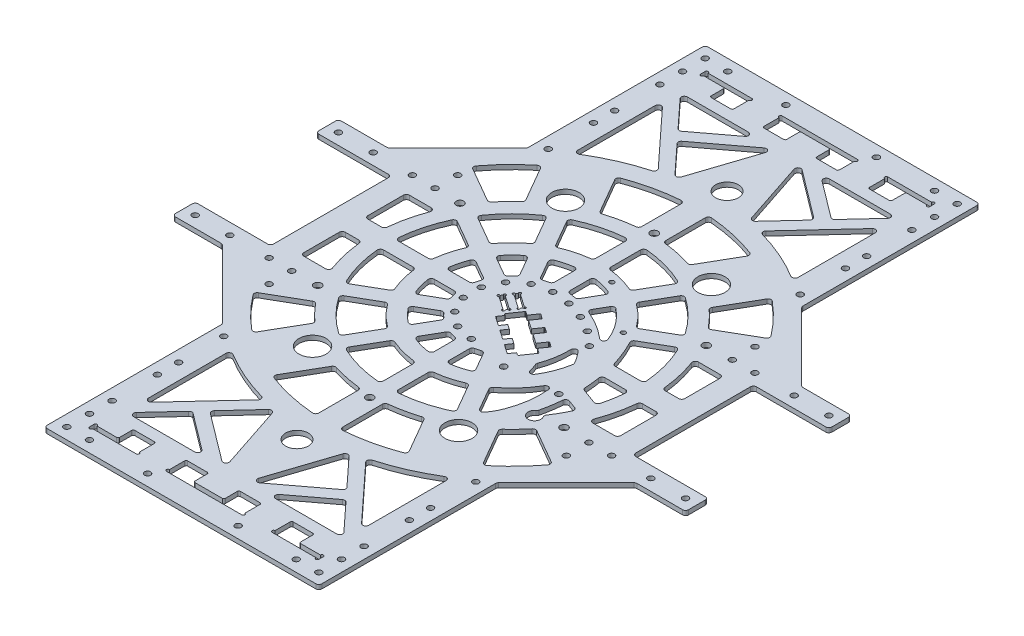
from build123d import *

# Parameters (mm, degrees)
EXTRUDE_2_OUTLINE_R   = 135
EXTRUDE_2_OUTLINE_R_2 = 2
EXTRUDE_2_DEPTH       = 3
SKETCH_7_R            = 2.5
SKETCH_7_R_2          = 1.5
CUT_EXTRUDE_3_DEPTH   = 191.942399692
EXTRUDE_START         = -3
SKETCH_8_R            = 135
EXTRUDE_3_DEPTH       = 3
SKETCH_9_R            = 0.75
SKETCH_9_R_2          = 2
SKETCH_9_W            = 31
SKETCH_9_H            = 3
SKETCH_9_W_2          = 50
SKETCH_9_H_2          = 80
CUT_EXTRUDE_4_DEPTH   = 278.254395817
FILLET_1_R            = 0.5
SKETCH_10_R           = 9
CUT_EXTRUDE_5_DEPTH   = 278.254395817
SKETCH_12_W           = 10
SKETCH_12_H           = 55
SKETCH_12_W_2         = 30
SKETCH_12_H_2         = 10
SKETCH_12_W_3         = 55
EXTRUDE_2_2_DEPTH     = 3
SKETCH_22_R           = 7.5
SKETCH_22_R_2         = 4.25
SKETCH_22_W           = 15
SKETCH_22_H           = 10
CUT_EXTRUDE_10_DEPTH  = 278.254395817
SKETCH_23_R           = 1
CUT_EXTRUDE_11_DEPTH  = 278.254395817
FILLET_2_R            = 2
FILLET_3_R            = 1
FILLET_5_R            = 2


with BuildPart() as part:
    # Extrude 2: read off the stored shape, not the designer's step
    # Extrude 2 outline → Extrude 2 (new body)
    with BuildSketch(Plane(origin=(0, 0, 0), x_dir=(1, 0, 0), z_dir=(0, 1, 0))):
        Circle(EXTRUDE_2_OUTLINE_R)
        with Locations((-11.714860956, -24.326159433)):
            Circle(EXTRUDE_2_OUTLINE_R_2, mode=Mode.SUBTRACT)
        with Locations((-21.109450027, -16.83422465)):
            Circle(EXTRUDE_2_OUTLINE_R_2, mode=Mode.SUBTRACT)
        with Locations((-26.323053629, -6.008065217)):
            Circle(EXTRUDE_2_OUTLINE_R_2, mode=Mode.SUBTRACT)
        with Locations((0, -27)):
            Circle(EXTRUDE_2_OUTLINE_R_2, mode=Mode.SUBTRACT)
        with Locations((60.645656918, -29.637042648)):
            Circle(EXTRUDE_2_OUTLINE_R_2, mode=Mode.SUBTRACT)
        with Locations((-26.323053629, 6.008065217)):
            Circle(EXTRUDE_2_OUTLINE_R_2, mode=Mode.SUBTRACT)
        with Locations((-21.109450027, 16.83422465)):
            Circle(EXTRUDE_2_OUTLINE_R_2, mode=Mode.SUBTRACT)
        with Locations((-11.714860956, 24.326159433)):
            Circle(EXTRUDE_2_OUTLINE_R_2, mode=Mode.SUBTRACT)
        with Locations((0, 27)):
            Circle(EXTRUDE_2_OUTLINE_R_2, mode=Mode.SUBTRACT)
        with Locations((12.026602226, 25.643716044)):
            Circle(EXTRUDE_2_OUTLINE_R_2, mode=Mode.SUBTRACT)
        with Locations((23.511562116, 21.826077559)):
            Circle(EXTRUDE_2_OUTLINE_R_2, mode=Mode.SUBTRACT)
        with Locations((43.261705064, 8.026510757)):
            Circle(EXTRUDE_2_OUTLINE_R_2, mode=Mode.SUBTRACT)
        with Locations((34.053247629, 15.880361974)):
            Circle(EXTRUDE_2_OUTLINE_R_2, mode=Mode.SUBTRACT)
    extrude(amount=EXTRUDE_2_DEPTH)

    # 草图7 → 切除-拉伸3 (cut, through all)
    with BuildSketch(Plane(origin=(0, 3, 0), x_dir=(1, 0, 0), z_dir=(0, 1, 0))):
        with Locations(Location((81.622894307, 47.125, 0), (0, 0, 270))):
            Circle(SKETCH_7_R)
        with Locations(Location((81.622894307, -47.125, 0), (0, 0, 270))):
            Circle(SKETCH_7_R)
        with Locations(Location((0, -94.25, 0), (0, 0, 270))):
            Circle(SKETCH_7_R)
        with Locations(Location((-81.622894307, -47.125, 0), (0, 0, 270))):
            Circle(SKETCH_7_R)
        with Locations(Location((-81.622894307, 47.125, 0), (0, 0, 270))):
            Circle(SKETCH_7_R)
        with Locations(Location((0, 94.25, 0), (0, 0, 270))):
            Circle(SKETCH_7_R)
        with Locations(Location((13.976228436, 52.15999462, 0), (0, 0, 270))):
            Circle(SKETCH_7_R_2)
        with Locations(Location((46.765371804, 27, 0), (0, 0, 270))):
            Circle(SKETCH_7_R_2)
        Polygon((2.302441407, 6.84642908), (-3.498658194, -1.543281489), (24.878304022, -21.164647786), (30.679403623, -12.774937218), align=None)
        Polygon((-10.035368253, 15.377457905), (-11.741574018, 12.909895973), (-1.87132629, 6.085072913), (-0.165120525, 8.552634845), align=None)
        Polygon((-5.966220126, 0.162924276), (-4.260014361, 2.630486208), (-14.130262089, 9.455309268), (-15.836467854, 6.987747336), align=None)
    extrude(amount=-CUT_EXTRUDE_3_DEPTH, mode=Mode.SUBTRACT)

    # 草图8 → 凸台-拉伸3 (add)
    with BuildSketch(Plane(origin=(0, 3, 0), x_dir=(1, 0, 0), z_dir=(0, 1, 0)).offset(EXTRUDE_START)):
        Polygon((170, 55), (170, -55), (137, -55), (91, -101), (91, -219), (-91, -219), (-91, -101), (-137, -55), (-170, -55), (-170, 55), (-137, 55), (-91, 101), (-91, 219), (91, 219), (91, 101), (137, 55), align=None)
        Circle(SKETCH_8_R, mode=Mode.SUBTRACT)
    extrude(amount=EXTRUDE_3_DEPTH)

    # 草图9 → 切除-拉伸4 (cut, through all)
    with BuildSketch(Plane(origin=(0, 3, 0), x_dir=(1, 0, 0), z_dir=(0, 1, 0))):
        with Locations((-1.87132629, 6.085072913)):
            Circle(SKETCH_9_R)
        with Locations((-0.165120525, 8.552634845)):
            Circle(SKETCH_9_R)
        with Locations((-10.035368253, 15.377457905)):
            Circle(SKETCH_9_R)
        with Locations((-11.741574018, 12.909895973)):
            Circle(SKETCH_9_R)
        with Locations((-14.130262089, 9.455309268)):
            Circle(SKETCH_9_R)
        with Locations((-15.836467854, 6.987747336)):
            Circle(SKETCH_9_R)
        with Locations((-4.260014361, 2.630486208)):
            Circle(SKETCH_9_R)
        with Locations((-5.966220126, 0.162924276)):
            Circle(SKETCH_9_R)
        with Locations(Location((162.5, 47.5, 0), (0, 0, 270))):
            Circle(SKETCH_9_R_2)
        with Locations(Location((139.5, 47.5, 0), (0, 0, 270))):
            Circle(SKETCH_9_R_2)
        with Locations(Location((98.5, 62.5, 0), (0, 0, 270))):
            Circle(SKETCH_9_R_2)
        with Locations(Location((98.5, 47.5, 0), (0, 0, 270))):
            Circle(SKETCH_9_R_2)
        with Locations(Location((113.5, 47.5, 0), (0, 0, 270))):
            Circle(SKETCH_9_R_2)
        with Locations(Location((162.5, -47.5, 0), (0, 0, 90))):
            Circle(SKETCH_9_R_2)
        with Locations(Location((139.5, -47.5, 0), (0, 0, 90))):
            Circle(SKETCH_9_R_2)
        with Locations(Location((113.5, -47.5, 0), (0, 0, 90))):
            Circle(SKETCH_9_R_2)
        with Locations(Location((98.5, -47.5, 0), (0, 0, 90))):
            Circle(SKETCH_9_R_2)
        with Locations(Location((98.5, -62.5, 0), (0, 0, 90))):
            Circle(SKETCH_9_R_2)
        with Locations(Location((-98.5, -62.5, 0), (0, 0, 270))):
            Circle(SKETCH_9_R_2)
        with Locations(Location((-98.5, -47.5, 0), (0, 0, 270))):
            Circle(SKETCH_9_R_2)
        with Locations(Location((-113.5, -47.5, 0), (0, 0, 270))):
            Circle(SKETCH_9_R_2)
        with Locations(Location((-139.5, -47.5, 0), (0, 0, 270))):
            Circle(SKETCH_9_R_2)
        with Locations(Location((-162.5, -47.5, 0), (0, 0, 270))):
            Circle(SKETCH_9_R_2)
        with Locations(Location((-113.5, 47.5, 0), (0, 0, 90))):
            Circle(SKETCH_9_R_2)
        with Locations(Location((-98.5, 47.5, 0), (0, 0, 90))):
            Circle(SKETCH_9_R_2)
        with Locations(Location((-98.5, 62.5, 0), (0, 0, 90))):
            Circle(SKETCH_9_R_2)
        with Locations(Location((-139.5, 47.5, 0), (0, 0, 90))):
            Circle(SKETCH_9_R_2)
        with Locations(Location((-162.5, 47.5, 0), (0, 0, 90))):
            Circle(SKETCH_9_R_2)
        with Locations(Location((68.5, 211.5, 0), (0, 0, 270))):
            Circle(SKETCH_9_R_2)
        with Locations(Location((83.5, 211.5, 0), (0, 0, 270))):
            Circle(SKETCH_9_R_2)
        with Locations(Location((83.5, 196.5, 0), (0, 0, 270))):
            Circle(SKETCH_9_R_2)
        with Locations(Location((83.5, 181.5, 0), (0, 0, 270))):
            Circle(SKETCH_9_R_2)
        with Locations(Location((83.5, 151.5, 0), (0, 0, 270))):
            Circle(SKETCH_9_R_2)
        with Locations(Location((83.5, -181.5, 0), (0, 0, 90))):
            Circle(SKETCH_9_R_2)
        with Locations(Location((83.5, -196.5, 0), (0, 0, 90))):
            Circle(SKETCH_9_R_2)
        with Locations(Location((83.5, -211.5, 0), (0, 0, 90))):
            Circle(SKETCH_9_R_2)
        with Locations(Location((68.5, -211.5, 0), (0, 0, 90))):
            Circle(SKETCH_9_R_2)
        with Locations(Location((-83.5, 181.5, 0), (0, 0, 90))):
            Circle(SKETCH_9_R_2)
        with Locations(Location((-83.5, 196.5, 0), (0, 0, 90))):
            Circle(SKETCH_9_R_2)
        with Locations(Location((-83.5, 211.5, 0), (0, 0, 90))):
            Circle(SKETCH_9_R_2)
        with Locations(Location((-68.5, 211.5, 0), (0, 0, 90))):
            Circle(SKETCH_9_R_2)
        with Locations(Location((-68.5, -211.5, 0), (0, 0, 270))):
            Circle(SKETCH_9_R_2)
        with Locations(Location((-83.5, -211.5, 0), (0, 0, 270))):
            Circle(SKETCH_9_R_2)
        with Locations(Location((-83.5, -196.5, 0), (0, 0, 270))):
            Circle(SKETCH_9_R_2)
        with Locations(Location((-83.5, -181.5, 0), (0, 0, 270))):
            Circle(SKETCH_9_R_2)
        with Locations(Location((30, 211.5, 0), (0, 0, 270))):
            Circle(SKETCH_9_R_2)
        with Locations(Location((-30, 211.5, 0), (0, 0, 90))):
            Circle(SKETCH_9_R_2)
        with Locations(Location((-30, -211.5, 0), (0, 0, 270))):
            Circle(SKETCH_9_R_2)
        with Locations(Location((30, -211.5, 0), (0, 0, 90))):
            Circle(SKETCH_9_R_2)
        with Locations(Location((83.5, 137.5, 0), (0, 0, 270))):
            Circle(SKETCH_9_R_2)
        with Locations(Location((83.5, 107.5, 0), (0, 0, 270))):
            Circle(SKETCH_9_R_2)
        with Locations(Location((-83.5, 107.5, 0), (0, 0, 90))):
            Circle(SKETCH_9_R_2)
        with Locations(Location((-83.5, 137.5, 0), (0, 0, 90))):
            Circle(SKETCH_9_R_2)
        with Locations(Location((-83.5, 151.5, 0), (0, 0, 90))):
            Circle(SKETCH_9_R_2)
        with Locations(Location((83.5, -151.5, 0), (0, 0, 90))):
            Circle(SKETCH_9_R_2)
        with Locations(Location((-83.5, -151.5, 0), (0, 0, 270))):
            Circle(SKETCH_9_R_2)
        with Locations(Location((83.5, -107.5, 0), (0, 0, 90))):
            Circle(SKETCH_9_R_2)
        with Locations(Location((83.5, -137.5, 0), (0, 0, 90))):
            Circle(SKETCH_9_R_2)
        with Locations(Location((-83.5, -137.5, 0), (0, 0, 270))):
            Circle(SKETCH_9_R_2)
        with Locations(Location((-83.5, -107.5, 0), (0, 0, 270))):
            Circle(SKETCH_9_R_2)
        Polygon((17.843517837, 4.003025594), (8.345639079, -9.73306916), (6.988480016, -8.79465599), (4.429171369, -12.495998888), (10.598076198, -16.7615133), (13.157384846, -13.060170402), (11.800225783, -12.121757231), (21.298104542, 1.614337523), align=None)
        Polygon((-2.306003261, -2.367947608), (-4.865311908, -6.069290506), (1.303592922, -10.334804919), (3.862901569, -6.633462021), (2.505742507, -5.69504885), (12.003621265, 8.041045904), (8.54903456, 10.429733975), (-0.948844198, -3.306360779), align=None)
        Polygon((21.588221446, -18.889706766), (31.086100205, -5.153612012), (27.6315135, -2.764923941), (18.133634742, -16.501018695), (16.776475679, -15.562605524), (14.217167032, -19.263948422), (20.386071861, -23.529462834), (22.945380509, -19.828119937), align=None)
        with Locations((-60.5, 202.5)):
            Rectangle(SKETCH_9_W, SKETCH_9_H)
        with Locations((60.5, 202.5)):
            Rectangle(SKETCH_9_W, SKETCH_9_H)
        with Locations((-145, 0)):
            Rectangle(SKETCH_9_W_2, SKETCH_9_H_2)
        with Locations((145, 0)):
            Rectangle(SKETCH_9_W_2, SKETCH_9_H_2)
        with Locations((0, 202.5)):
            Rectangle(SKETCH_9_W_2, SKETCH_9_H)
        with Locations((-60.5, -202.5)):
            Rectangle(SKETCH_9_W, SKETCH_9_H)
        with Locations((0, -202.5)):
            Rectangle(SKETCH_9_W_2, SKETCH_9_H)
        with Locations((60.5, -202.5)):
            Rectangle(SKETCH_9_W, SKETCH_9_H)
    extrude(amount=-CUT_EXTRUDE_4_DEPTH, mode=Mode.SUBTRACT)

    # 圆角1
    fillet_1_edges = [part.edges().sort_by_distance(p)[0] for p in [
        (2.302441407, 1.5, -6.84642908),
        (30.679403623, 1.5, 12.774937218),
        (24.878304022, 1.5, 21.164647786),
        (-3.498658194, 1.5, 1.543281489),
        (21.298104542, 1.5, -1.614337523),
        (4.429171369, 1.5, 12.495998888),
        (17.843517837, 1.5, -4.003025594),
        (10.598076198, 1.5, 16.7615133),
        (31.086100205, 1.5, 5.153612012),
        (14.217167032, 1.5, 19.263948422),
        (27.6315135, 1.5, 2.764923941),
        (20.386071861, 1.5, 23.529462834),
        (12.003621265, 1.5, -8.041045904),
        (8.54903456, 1.5, -10.429733975),
        (1.303592922, 1.5, 10.334804919),
        (-4.865311908, 1.5, 6.069290506),
    ]]
    fillet(fillet_1_edges, radius=FILLET_1_R)

    # 草图10 → 切除-拉伸5 (cut, through all)
    with BuildSketch(Plane(origin=(0, 3, 0), x_dir=(1, 0, 0), z_dir=(0, 1, 0))):
        with Locations(Location((-48.375, 83.787957816, 0), (0, 0, 270))):
            Circle(SKETCH_10_R)
        with Locations(Location((48.375, 83.787957816, 0), (0, 0, 270))):
            Circle(SKETCH_10_R)
        with Locations(Location((48.375, -83.787957816, 0), (0, 0, 270))):
            Circle(SKETCH_10_R)
        with Locations(Location((-48.375, -83.787957816, 0), (0, 0, 270))):
            Circle(SKETCH_10_R)
        with BuildLine():
            ThreePointArc((49.077709935, 32.747189003), (-58.972573029, -1.798785793), (50.982330794, -29.695150225))
            ThreePointArc((50.982330794, -29.695150225), (53.143344948, -28.74915581), (54.702238888, -30.519674744))
            ThreePointArc((54.702238888, -30.519674744), (54.388557403, -43.597514939), (51.097814518, -56.258451378))
            ThreePointArc((51.097814518, -56.258451378), (43.410017969, -68.216294527), (31.641546407, -76.190961019))
            ThreePointArc((31.641546407, -76.190961019), (-50.864784063, 64.954012518), (66.382772067, -48.985483285))
            ThreePointArc((66.382772067, -48.985483285), (63.918206381, -49.605851668), (62.834701724, -47.306947883))
            ThreePointArc((62.834701724, -47.306947883), (64.450515138, -5.820165452), (49.077709935, 32.747189003))
        make_face()
        with BuildLine():
            ThreePointArc((47.879261128, 10.419997784), (-45.759993791, 17.522070889), (28.674854812, -39.733521132))
            ThreePointArc((28.674854812, -39.733521132), (28.938606013, -35.765708372), (28.691050958, -31.796852203))
            ThreePointArc((28.691050958, -31.796852203), (28.264061739, -30.794139817), (27.37474082, -30.164171385))
            ThreePointArc((27.37474082, -30.164171385), (19.028783253, -28.72993028), (10.682825686, -30.164171385))
            ThreePointArc((10.682825686, -30.164171385), (-31.537703505, -5.419710104), (4.1e-08, 32))
            ThreePointArc((4.1e-08, 32), (6.611735111, 31.628363067), (13.140176467, 30.518134205))
            ThreePointArc((13.140176467, 30.518134205), (32.027953382, 23.09329337), (47.879261128, 10.419997784))
        make_face()
        with BuildLine():
            ThreePointArc((38.570016524, -30.221744247), (37.469285963, -24.834509029), (35.65634663, -19.643443431))
            ThreePointArc((35.65634663, -19.643443431), (38.766523838, -7.204776194), (38.611094695, 5.615890195))
            ThreePointArc((38.611094695, 5.615890195), (43.988206529, -0.464963146), (48.462510212, -7.23775545))
            ThreePointArc((48.462510212, -7.23775545), (45.008122742, -19.371858125), (38.570016524, -30.221744247))
        make_face()
    extrude(amount=-CUT_EXTRUDE_5_DEPTH, mode=Mode.SUBTRACT)

    # 草图12 → Extrude 2 2 (add)
    with BuildSketch(Plane(origin=(0, 3, 0), x_dir=(1, 0, 0), z_dir=(0, 1, 0))):
        with Locations((0, 56.5)):
            Rectangle(SKETCH_12_W, SKETCH_12_H)
        Polygon((19.70900895, 24.137004868), (46.330127019, 70.246133918), (37.669872981, 75.246133918), (11.048754912, 29.137004868), align=None)
        Polygon((50.997422612, 23.669872981), (75.246133918, 37.669872981), (70.246133918, 46.330127019), (45.997422612, 32.330127019), align=None)
        with Locations((69, 0)):
            Rectangle(SKETCH_12_W_2, SKETCH_12_H_2)
        Polygon((10.798129487, -28.702908898), (37.669872981, -75.246133918), (46.330127019, -70.246133918), (19.458383525, -23.702908898), align=None)
        with Locations((0, -56.5)):
            Rectangle(SKETCH_12_W, SKETCH_12_H)
        Polygon((-18.792378281, -22.549353978), (-46.330127019, -70.246133918), (-37.669872981, -75.246133918), (-10.132124243, -27.549353978), align=None)
        Polygon((-27.61473671, -10.169872981), (-75.246133918, -37.669872981), (-70.246133918, -46.330127019), (-22.61473671, -18.830127019), align=None)
        with Locations((-56.5, 0)):
            Rectangle(SKETCH_12_W_3, SKETCH_12_H_2)
        Polygon((-22.61473671, 18.830127019), (-70.246133918, 46.330127019), (-75.246133918, 37.669872981), (-27.61473671, 10.169872981), align=None)
        Polygon((-10.169872981, 27.61473671), (-37.669872981, 75.246133918), (-46.330127019, 70.246133918), (-18.830127019, 22.61473671), align=None)
        Polygon((49.033300806, -23.167550844), (77.224079429, -33.428155143), (80.644280863, -24.031228935), (52.453502239, -13.770624636), align=None)
    extrude(amount=-EXTRUDE_2_2_DEPTH)

    # 草图22 → 切除-拉伸10 (cut, through all)
    with BuildSketch(Plane(origin=(0, 3, 0), x_dir=(1, 0, 0), z_dir=(0, 1, 0))):
        with Locations(Location((0, 142.5, 0), (0, 0, 270))):
            Circle(SKETCH_22_R)
        with Locations((64.961443453, -50.040092571)):
            Circle(SKETCH_22_R_2)
        with Locations(Location((0, -142.5, 0), (0, 0, 90))):
            Circle(SKETCH_22_R)
        with BuildLine():
            Line((-105, 7.5), (-105, 35))
            Line((-105, 35), (-85.622718948, 35))
            ThreePointArc((-85.622718948, 35), (-89.966034254, 21.502620318), (-92.195444573, 7.5))
            Line((-92.195444573, 7.5), (-105, 7.5))
        make_face()
        with BuildLine():
            Line((29.77741647, 87.575998244), (44.996710059, 113.936587995))
            ThreePointArc((44.996710059, 113.936587995), (26.821507042, 119.527640151), (8, 122.238496391))
            Line((8, 122.238496391), (8, 92.153404712))
            ThreePointArc((8, 92.153404712), (19.026861572, 90.521978208), (29.77741647, 87.575998244))
        make_face()
        with BuildLine():
            Line((92.195444573, 7.5), (105, 7.5))
            Line((105, 7.5), (105, 35))
            Line((105, 35), (85.622718948, 35))
            ThreePointArc((85.622718948, 35), (89.966034254, 21.502620318), (92.195444573, 7.5))
        make_face()
        with BuildLine():
            Line((72.812278368, 57.049295515), (98.989039715, 72.162455725))
            ThreePointArc((98.989039715, 72.162455725), (88.384342976, 84.820150417), (76.173624595, 95.936587995))
            Line((76.173624595, 95.936587995), (60.954331006, 69.575998244))
            ThreePointArc((60.954331006, 69.575998244), (67.175933311, 63.589653119), (72.812278368, 57.049295515))
        make_face()
        with BuildLine():
            Line((105, -35), (85.622718948, -35))
            ThreePointArc((85.622718948, -35), (89.966034254, -21.502620318), (92.195444573, -7.5))
            Line((92.195444573, -7.5), (105, -7.5))
            Line((105, -7.5), (105, -35))
        make_face()
        with BuildLine():
            Line((33.504478555, 130.260124047), (73, 172.96570276))
            Line((73, 172.96570276), (73, 112.96570276))
            ThreePointArc((73, 112.96570276), (53.949747358, 123.205822752), (33.504478555, 130.260124047))
        make_face()
        with BuildLine():
            Line((-73, 172.96570276), (-73, 112.96570276))
            ThreePointArc((-73, 112.96570276), (-53.949747358, 123.205822752), (-33.504478555, 130.260124047))
            Line((-33.504478555, 130.260124047), (-73, 172.96570276))
        make_face()
        with BuildLine():
            Line((-60.954331006, 69.575998244), (-76.173624595, 95.936587995))
            ThreePointArc((-76.173624595, 95.936587995), (-88.384342976, 84.820150417), (-98.989039715, 72.162455725))
            Line((-98.989039715, 72.162455725), (-72.812278368, 57.049295515))
            ThreePointArc((-72.812278368, 57.049295515), (-67.175933311, 63.589653119), (-60.954331006, 69.575998244))
        make_face()
        with BuildLine():
            Line((-8, 92.153404712), (-8, 122.238496391))
            ThreePointArc((-8, 122.238496391), (-26.821507042, 119.527640151), (-44.996710059, 113.936587995))
            Line((-44.996710059, 113.936587995), (-29.77741647, 87.575998244))
            ThreePointArc((-29.77741647, 87.575998244), (-19.026861572, 90.521978208), (-8, 92.153404712))
        make_face()
        with BuildLine():
            Line((72.812278368, -57.049295515), (98.989039715, -72.162455725))
            ThreePointArc((98.989039715, -72.162455725), (88.384342976, -84.820150417), (76.173624595, -95.936587995))
            Line((76.173624595, -95.936587995), (60.954331006, -69.575998244))
            ThreePointArc((60.954331006, -69.575998244), (67.175933311, -63.589653119), (72.812278368, -57.049295515))
        make_face()
        with BuildLine():
            Line((-29.77741647, -87.575998244), (-44.996710059, -113.936587995))
            ThreePointArc((-44.996710059, -113.936587995), (-26.821507042, -119.527640151), (-8, -122.238496391))
            Line((-8, -122.238496391), (-8, -92.153404712))
            ThreePointArc((-8, -92.153404712), (-19.026861572, -90.521978208), (-29.77741647, -87.575998244))
        make_face()
        with BuildLine():
            Line((-72.812278368, -57.049295515), (-98.989039715, -72.162455725))
            ThreePointArc((-98.989039715, -72.162455725), (-88.384342976, -84.820150417), (-76.173624595, -95.936587995))
            Line((-76.173624595, -95.936587995), (-60.954331006, -69.575998244))
            ThreePointArc((-60.954331006, -69.575998244), (-67.175933311, -63.589653119), (-72.812278368, -57.049295515))
        make_face()
        with BuildLine():
            Line((8, -92.153404712), (8, -122.238496391))
            ThreePointArc((8, -122.238496391), (26.821507042, -119.527640151), (44.996710059, -113.936587995))
            Line((44.996710059, -113.936587995), (29.77741647, -87.575998244))
            ThreePointArc((29.77741647, -87.575998244), (19.026861572, -90.521978208), (8, -92.153404712))
        make_face()
        with BuildLine():
            Line((-92.195444573, -7.5), (-105, -7.5))
            Line((-105, -7.5), (-105, -35))
            Line((-105, -35), (-85.622718948, -35))
            ThreePointArc((-85.622718948, -35), (-89.966034254, -21.502620318), (-92.195444573, -7.5))
        make_face()
        with Locations((-52.5, 196)):
            Rectangle(SKETCH_22_W, SKETCH_22_H)
        with Locations((-17.5, 196)):
            Rectangle(SKETCH_22_W, SKETCH_22_H)
        with Locations((17.5, 196)):
            Rectangle(SKETCH_22_W, SKETCH_22_H)
        with Locations((52.5, 196)):
            Rectangle(SKETCH_22_W, SKETCH_22_H)
        with Locations((52.5, -196)):
            Rectangle(SKETCH_22_W, SKETCH_22_H)
        with Locations((17.5, -196)):
            Rectangle(SKETCH_22_W, SKETCH_22_H)
        with Locations((-17.5, -196)):
            Rectangle(SKETCH_22_W, SKETCH_22_H)
        with Locations((-52.5, -196)):
            Rectangle(SKETCH_22_W, SKETCH_22_H)
        Polygon((20.793956755, 183.5), (71.845665855, 183.5), (50.880248519, 160.830587178), align=None)
        Polygon((7.5, 183.5), (45.420816185, 154.927431358), (24.455398849, 132.258018536), align=None)
        Polygon((-20.793956755, 183.5), (-71.845665855, 183.5), (-50.880248519, 160.830587178), align=None)
        Polygon((-24.455398849, 132.258018536), (-7.5, 183.5), (-45.420816185, 154.927431358), align=None)
        with BuildLine():
            Line((-73, -172.96570276), (-73, -112.96570276))
            ThreePointArc((-73, -112.96570276), (-53.949747358, -123.205822752), (-33.504478555, -130.260124047))
            Line((-33.504478555, -130.260124047), (-73, -172.96570276))
        make_face()
        Polygon((-20.793956755, -183.5), (-71.845665855, -183.5), (-50.880248519, -160.830587178), align=None)
        Polygon((-7.5, -183.5), (-45.420816185, -154.927431358), (-24.455398849, -132.258018536), align=None)
        Polygon((24.455398849, -132.258018536), (7.5, -183.5), (45.420816185, -154.927431358), align=None)
        Polygon((50.880248519, -160.830587178), (20.793956755, -183.5), (71.845665855, -183.5), align=None)
        with BuildLine():
            Line((73, -172.96570276), (73, -112.96570276))
            ThreePointArc((73, -112.96570276), (53.949747358, -123.205822752), (33.504478555, -130.260124047))
            Line((33.504478555, -130.260124047), (73, -172.96570276))
        make_face()
    extrude(amount=-CUT_EXTRUDE_10_DEPTH, mode=Mode.SUBTRACT)

    # 草图23 → 切除-拉伸11 (cut, through all)
    with BuildSketch(Plane(origin=(0, 3, 0), x_dir=(1, 0, 0), z_dir=(0, 1, 0))):
        with Locations((75, 204)):
            Circle(SKETCH_23_R)
        with Locations((75, 201)):
            Circle(SKETCH_23_R)
        with Locations((45, 203)):
            Circle(SKETCH_23_R)
        with Locations((25, 203)):
            Circle(SKETCH_23_R)
        with Locations((-25, 203)):
            Circle(SKETCH_23_R)
        with Locations((-45, 203)):
            Circle(SKETCH_23_R)
        with Locations((-75, 201)):
            Circle(SKETCH_23_R)
        with Locations((-75, 204)):
            Circle(SKETCH_23_R)
        with Locations((-75, -204)):
            Circle(SKETCH_23_R)
        with Locations((-75, -201)):
            Circle(SKETCH_23_R)
        with Locations((-45, -203)):
            Circle(SKETCH_23_R)
        with Locations((-25, -203)):
            Circle(SKETCH_23_R)
        with Locations((25, -203)):
            Circle(SKETCH_23_R)
        with Locations((45, -203)):
            Circle(SKETCH_23_R)
        with Locations((75, -201)):
            Circle(SKETCH_23_R)
        with Locations((75, -204)):
            Circle(SKETCH_23_R)
    extrude(amount=-CUT_EXTRUDE_11_DEPTH, mode=Mode.SUBTRACT)

    # 圆角2
    fillet_2_edges = [part.edges().sort_by_distance(p)[0] for p in [
        (91, 1.5, -101),
        (91, 1.5, -219),
        (-91, 1.5, -219),
        (-91, 1.5, -101),
        (-137, 1.5, -55),
        (-170, 1.5, -55),
        (-170, 1.5, 55),
        (-137, 1.5, 55),
        (-91, 1.5, 101),
        (-91, 1.5, 219),
        (91, 1.5, 219),
        (91, 1.5, 101),
        (137, 1.5, 55),
        (170, 1.5, 55),
        (170, 1.5, -55),
        (137, 1.5, -55),
        (63.104135532, 1.5, 46.217409313),
        (67.85402572, 1.5, 46.926337952),
        (-170, 1.5, 40),
        (-170, 1.5, -40),
        (170, 1.5, -40),
        (170, 1.5, 40),
    ]]
    fillet(fillet_2_edges, radius=FILLET_2_R)

    # 圆角3
    fillet_3_edges = [part.edges().sort_by_distance(p)[0] for p in [
        (45, 1.5, 191),
        (60, 1.5, 191),
        (60, 1.5, 201),
        (60, 1.5, -201),
        (60, 1.5, -191),
        (45, 1.5, -191),
        (25, 1.5, 191),
        (10, 1.5, 201),
        (10, 1.5, 191),
        (-10, 1.5, 201),
        (-25, 1.5, 191),
        (-10, 1.5, 191),
        (-60, 1.5, 201),
        (-60, 1.5, 191),
        (-45, 1.5, 191),
        (-45, 1.5, -191),
        (-60, 1.5, -191),
        (-60, 1.5, -201),
        (-25, 1.5, -191),
        (-10, 1.5, -201),
        (-10, 1.5, -191),
        (10, 1.5, -201),
        (25, 1.5, -191),
        (10, 1.5, -191),
    ]]
    fillet(fillet_3_edges, radius=FILLET_3_R)

    # 圆角5
    fillet_5_edges = [part.edges().sort_by_distance(p)[0] for p in [
        (73.815759128, 1.5, -36.844045711),
        (68.815759128, 1.5, -45.504299749),
        (28.702242233, 1.5, -39.713741838),
        (20.041988195, 1.5, -44.713741838),
        (36.844045711, 1.5, -73.815759128),
        (25.063749894, 1.5, -53.411688245),
        (11.990804121, 1.5, -30.768681962),
        (33.724003932, 1.5, -48.411688245),
        (21.877835654, 1.5, -27.893522913),
        (45.504299749, 1.5, -68.815759128),
        (36.712855229, 1.5, 73.588530547),
        (44.490119117, 1.5, 67.059146746),
        (33.724003932, 1.5, 48.411688245),
        (22.500594818, 1.5, 28.972173426),
        (28.682011536, 1.5, 39.678701244),
        (11.486298547, 1.5, 29.894852675),
        (20.041988195, 1.5, 44.713741838),
        (25.063749894, 1.5, 53.411688245),
        (64.306054367, 1.5, 5),
        (61.965830603, 1.5, -5),
        (82.34834546, 1.5, -5),
        (82.34834546, 1.5, 5),
        (5, 1.5, 31.606961259),
        (5, 1.5, 48.744230428),
        (5, 1.5, 82.34834546),
        (5, 1.5, 58.787753827),
        (-5, 1.5, 31.606961259),
        (-5, 1.5, 58.787753827),
        (-5, 1.5, 48.744230428),
        (-5, 1.5, 82.34834546),
        (-11.47335361, 1.5, 29.872431386),
        (-20.041988195, 1.5, 44.713741838),
        (-36.844045711, 1.5, 73.815759128),
        (-25.063749894, 1.5, 53.411688245),
        (-20.133607648, 1.5, 24.872431386),
        (-33.724003932, 1.5, 48.411688245),
        (-28.702242233, 1.5, 39.713741838),
        (-45.504299749, 1.5, 68.815759128),
        (-24.872431386, 1.5, 20.133607648),
        (-39.713741838, 1.5, 28.702242233),
        (-68.815759128, 1.5, 45.504299749),
        (-48.411688245, 1.5, 33.724003932),
        (-29.872431386, 1.5, 11.47335361),
        (-53.411688245, 1.5, 25.063749894),
        (-44.713741838, 1.5, 20.041988195),
        (-73.815759128, 1.5, 36.844045711),
        (-31.606961259, 1.5, 5),
        (-48.744230428, 1.5, 5),
        (-82.34834546, 1.5, 5),
        (-58.787753827, 1.5, 5),
        (-31.606961259, 1.5, -5),
        (-58.787753827, 1.5, -5),
        (-48.744230428, 1.5, -5),
        (-82.34834546, 1.5, -5),
        (-29.872431386, 1.5, -11.47335361),
        (-44.713741838, 1.5, -20.041988195),
        (-73.815759128, 1.5, -36.844045711),
        (-53.411688245, 1.5, -25.063749894),
        (-24.872431386, 1.5, -20.133607648),
        (-48.411688245, 1.5, -33.724003932),
        (-39.713741838, 1.5, -28.702242233),
        (-68.815759128, 1.5, -45.504299749),
        (-20.133607648, 1.5, -24.872431386),
        (-28.702242233, 1.5, -39.713741838),
        (-45.504299749, 1.5, -68.815759128),
        (-33.724003932, 1.5, -48.411688245),
        (-11.47335361, 1.5, -29.872431386),
        (-25.063749894, 1.5, -53.411688245),
        (-20.041988195, 1.5, -44.713741838),
        (-36.844045711, 1.5, -73.815759128),
        (65.685501248, 1.5, 29.228456139),
        (65.810056675, 1.5, 18.632012883),
        (79.092233279, 1.5, 23.466329813),
        (75.672031846, 1.5, 32.863256021),
        (8, 1.5, 92.153404712),
        (29.77741647, 1.5, 87.575998244),
        (44.996710059, 1.5, 113.936587995),
        (8, 1.5, 122.238496391),
        (33.504478555, 1.5, 130.260124047),
        (73, 1.5, 112.96570276),
        (73, 1.5, 172.96570276),
        (-105, 1.5, 35),
        (-105, 1.5, 7.5),
        (-92.195444573, 1.5, 7.5),
        (-85.622718948, 1.5, 35),
        (-8, 1.5, 122.238496391),
        (-44.996710059, 1.5, 113.936587995),
        (-29.77741647, 1.5, 87.575998244),
        (-8, 1.5, 92.153404712),
        (-72.812278368, 1.5, 57.049295515),
        (-60.954331006, 1.5, 69.575998244),
        (-76.173624595, 1.5, 95.936587995),
        (-98.989039715, 1.5, 72.162455725),
        (-73, 1.5, 112.96570276),
        (-33.504478555, 1.5, 130.260124047),
        (-73, 1.5, 172.96570276),
        (-50.880248519, 1.5, 160.830587178),
        (-20.793956755, 1.5, 183.5),
        (-71.845665855, 1.5, 183.5),
        (-24.455398849, 1.5, 132.258018536),
        (-7.5, 1.5, 183.5),
        (-45.420816185, 1.5, 154.927431358),
        (-20.793956755, 1.5, -183.5),
        (-50.880248519, 1.5, -160.830587178),
        (-71.845665855, 1.5, -183.5),
        (-24.455398849, 1.5, -132.258018536),
        (-45.420816185, 1.5, -154.927431358),
        (-7.5, 1.5, -183.5),
        (-85.622718948, 1.5, -35),
        (-92.195444573, 1.5, -7.5),
        (-105, 1.5, -7.5),
        (-105, 1.5, -35),
        (73, 1.5, -112.96570276),
        (33.504478555, 1.5, -130.260124047),
        (73, 1.5, -172.96570276),
        (105, 1.5, -35),
        (105, 1.5, -7.5),
        (92.195444573, 1.5, -7.5),
        (85.622718948, 1.5, -35),
        (50.880248519, 1.5, -160.830587178),
        (20.793956755, 1.5, -183.5),
        (71.845665855, 1.5, -183.5),
        (105, 1.5, 7.5),
        (105, 1.5, 35),
        (85.622718948, 1.5, 35),
        (92.195444573, 1.5, 7.5),
        (76.173624595, 1.5, -95.936587995),
        (98.989039715, 1.5, -72.162455725),
        (72.812278368, 1.5, -57.049295515),
        (60.954331006, 1.5, -69.575998244),
        (60.954331006, 1.5, 69.575998244),
        (72.812278368, 1.5, 57.049295515),
        (98.989039715, 1.5, 72.162455725),
        (76.173624595, 1.5, 95.936587995),
        (24.455398849, 1.5, -132.258018536),
        (7.5, 1.5, -183.5),
        (45.420816185, 1.5, -154.927431358),
        (-33.504478555, 1.5, -130.260124047),
        (-73, 1.5, -112.96570276),
        (-73, 1.5, -172.96570276),
        (-98.989039715, 1.5, -72.162455725),
        (-76.173624595, 1.5, -95.936587995),
        (-60.954331006, 1.5, -69.575998244),
        (-72.812278368, 1.5, -57.049295515),
        (-8, 1.5, -92.153404712),
        (-29.77741647, 1.5, -87.575998244),
        (-44.996710059, 1.5, -113.936587995),
        (-8, 1.5, -122.238496391),
        (50.880248519, 1.5, 160.830587178),
        (71.845665855, 1.5, 183.5),
        (20.793956755, 1.5, 183.5),
        (24.455398849, 1.5, 132.258018536),
        (45.420816185, 1.5, 154.927431358),
        (7.5, 1.5, 183.5),
        (29.77741647, 1.5, -87.575998244),
        (8, 1.5, -92.153404712),
        (8, 1.5, -122.238496391),
        (44.996710059, 1.5, -113.936587995),
        (-120, 1.5, -40),
        (-120, 1.5, 40),
        (120, 1.5, -40),
        (120, 1.5, 40),
        (47.879261128, 1.5, -10.419997784),
        (10.682825686, 1.5, 30.164171385),
        (48.462510212, 1.5, 7.23775545),
        (38.570016524, 1.5, 30.221744247),
        (35.65634663, 1.5, 19.643443431),
        (38.611094695, 1.5, -5.615890195),
        (5, 1.5, -58.787753827),
        (-5, 1.5, -58.787753827),
        (-5, 1.5, -31.606961259),
        (-5, 1.5, -48.744230428),
        (-5, 1.5, -82.34834546),
        (5, 1.5, -31.787753803),
        (5, 1.5, -48.744230428),
        (5, 1.5, -82.34834546),
        (48.411688245, 1.5, -33.724003932),
        (53.646232062, 1.5, -25.19916383),
    ]]
    fillet(fillet_5_edges, radius=FILLET_5_R)


solid = part.part
